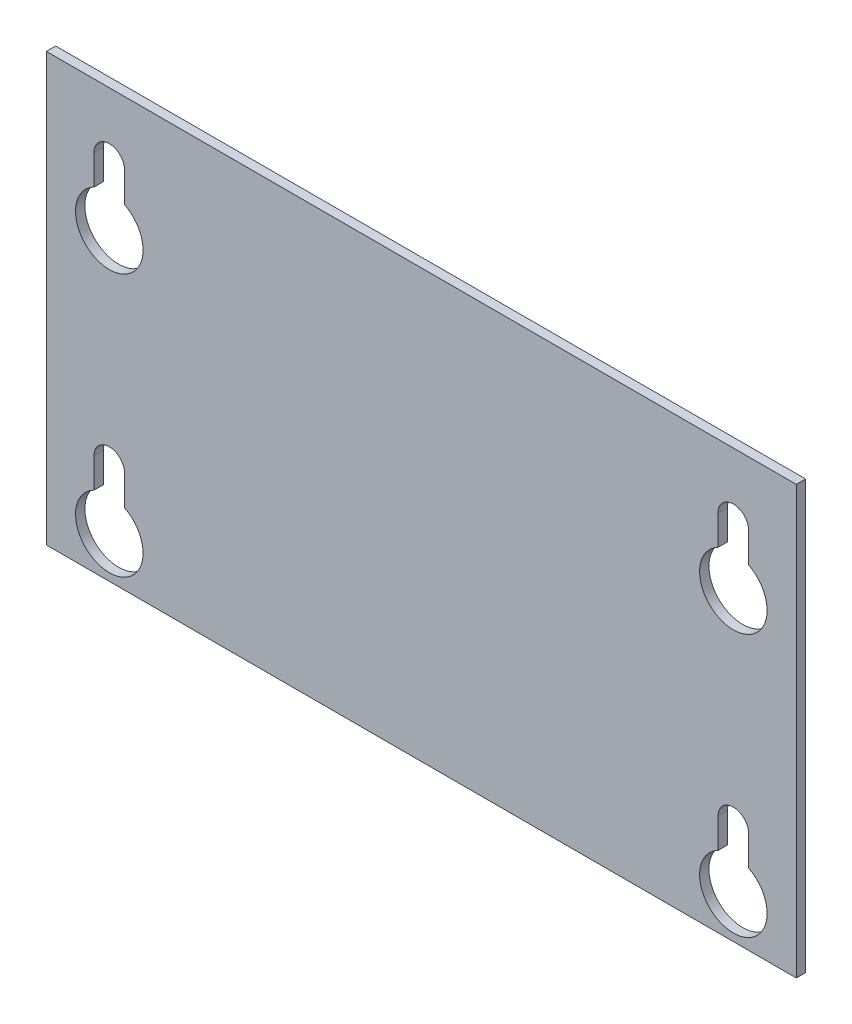
from build123d import *

# Parameters (mm, degrees)
SKETCH1_W          = 100
SKETCH1_H          = 62
BASE_FLANGE1_DEPTH = 1.245
CUT_EXTRUDE7_DEPTH = 10
MOVE_FACE1_BY      = 5


# Sheet-metal steps are written as plain solids
with BuildPart() as part:
    # Sketch1 → Base-Flange1 (new body)
    with BuildSketch(Plane.XY):
        Rectangle(SKETCH1_W, SKETCH1_H)
    extrude(amount=-BASE_FLANGE1_DEPTH)

    # Sketch6 → Cut-Extrude7 (cut)
    with BuildSketch(Plane.XY):
        with BuildLine():
            Line((-43.645, 17.5), (-43.645, 13.511034779))
            ThreePointArc((-43.645, 13.511034779), (-41.605, 5), (-39.565, 13.511034779))
            Line((-39.565, 13.511034779), (-39.565, 17.5))
            ThreePointArc((-39.565, 17.5), (-41.605, 19.54), (-43.645, 17.5))
        make_face()
        with BuildLine():
            Line((39.565, 17.5), (39.565, 13.511034779))
            ThreePointArc((39.565, 13.511034779), (41.605, 5), (43.645, 13.511034779))
            Line((43.645, 13.511034779), (43.645, 17.5))
            ThreePointArc((43.645, 17.5), (41.605, 19.54), (39.565, 17.5))
        make_face()
        with BuildLine():
            Line((-43.645, -17.5), (-43.645, -21.488965221))
            ThreePointArc((-43.645, -21.488965221), (-41.605, -30), (-39.565, -21.488965221))
            Line((-39.565, -21.488965221), (-39.565, -17.5))
            ThreePointArc((-39.565, -17.5), (-41.605, -15.46), (-43.645, -17.5))
        make_face()
        with BuildLine():
            Line((39.565, -17.5), (39.565, -21.488965221))
            ThreePointArc((39.565, -21.488965221), (41.605, -30), (43.645, -21.488965221))
            Line((43.645, -21.488965221), (43.645, -17.5))
            ThreePointArc((43.645, -17.5), (41.605, -15.46), (39.565, -17.5))
        make_face()
    extrude(amount=-CUT_EXTRUDE7_DEPTH, mode=Mode.SUBTRACT)

    # Move Face1: a face moved inward by 5.0
    extrude(part.faces().sort_by_distance((0, 31, -0.6225))[0], amount=MOVE_FACE1_BY, dir=(0, -1, 0), mode=Mode.SUBTRACT)


solid = part.part
